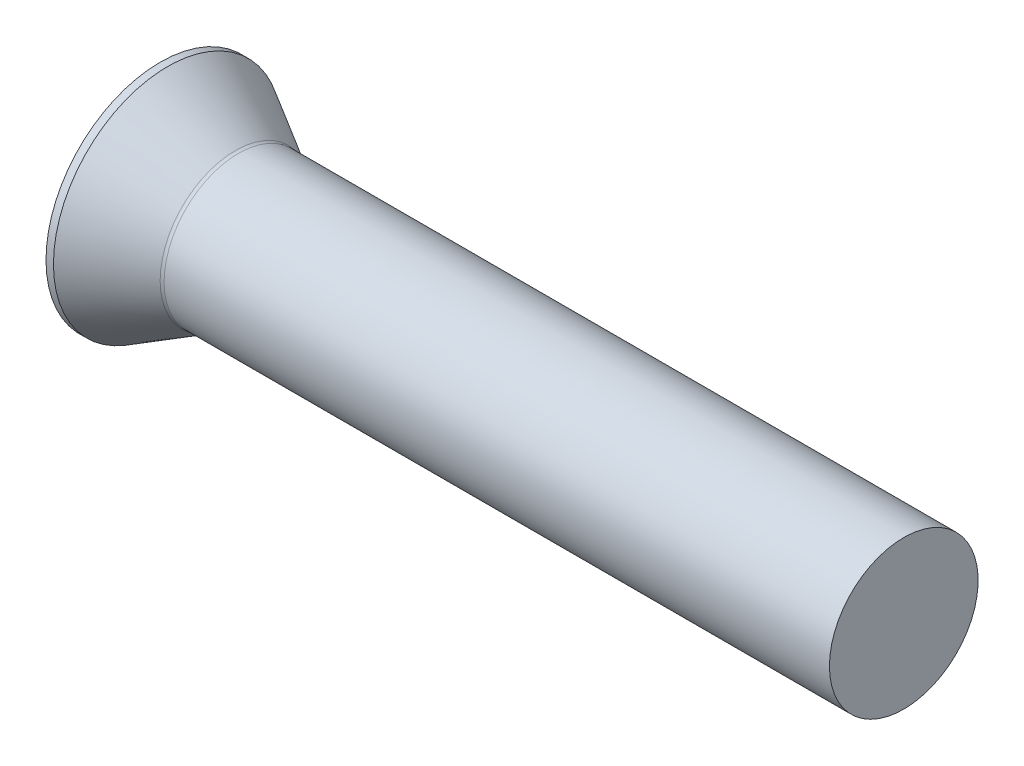
from build123d import *


with BuildPart() as part:
    # Sketch1 → Base-Revolve (revolve)
    with BuildSketch(Plane.XY):
        with BuildLine():
            Line((62.62501402, 0), (62.62501402, 6))
            Line((62.62501402, 6), (8.933974596, 6))
            ThreePointArc((8.933974596, 6), (8.804565074, 6.017037087), (8.683974596, 6.066987298))
            Line((8.683974596, 6.066987298), (3.22501402, 9.218719656))
            Line((3.22501402, 9.218719656), (2.62501402, 9.218719656))
            ThreePointArc((2.62501402, 9.218719656), (0.66904259, 4.792585177), (0, 0))
            Line((0, 0), (62.62501402, 0))
        make_face()
    revolve(axis=Axis((-34.729888268, 0, 0), (1, 0, 0)))


solid = part.part
